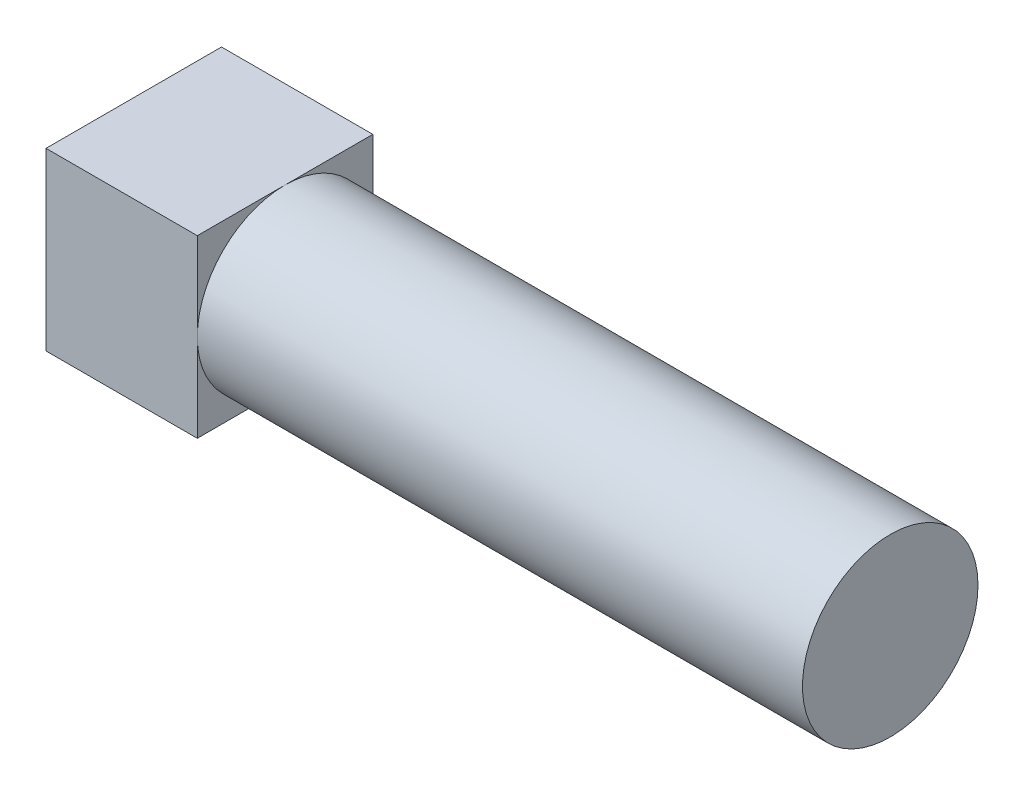
from build123d import *

# Parameters (mm, degrees)
SKETCH1_W           = 11.6
SKETCH1_H           = 11.6
BOSS_EXTRUDE1_DEPTH = 10
SKETCH2_R           = 5.8
BOSS_EXTRUDE2_DEPTH = 40


with BuildPart() as part:
    # Sketch1 → Boss-Extrude1 (new body)
    with BuildSketch(Plane(origin=(0, 0, 0), x_dir=(0, 0, -1), z_dir=(1, 0, 0))):
        Rectangle(SKETCH1_W, SKETCH1_H)
    extrude(amount=BOSS_EXTRUDE1_DEPTH)

    # Sketch2 → Boss-Extrude2 (add)
    with BuildSketch(Plane(origin=(10, 0, 0), x_dir=(0, 0, -1), z_dir=(1, 0, 0))):
        Circle(SKETCH2_R)
    extrude(amount=BOSS_EXTRUDE2_DEPTH)


solid = part.part
